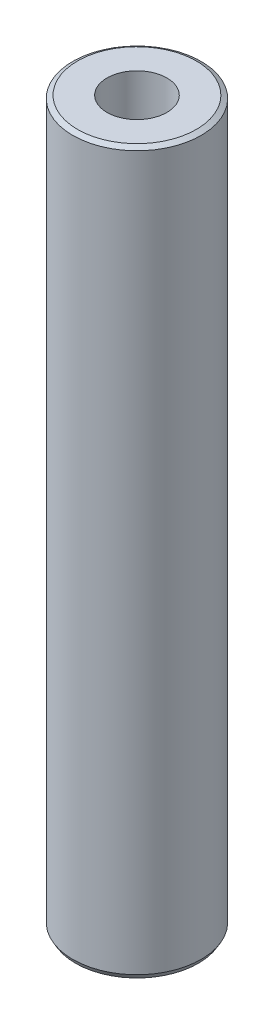
from build123d import *
from OCP.BRepFilletAPI import BRepFilletAPI_MakeChamfer

# Parameters (mm, degrees)
SKETCH1_R           = 50
BOSS_EXTRUDE1_DEPTH = 561.899542214
SKETCH2_R           = 23.319414117
CUT_EXTRUDE1_DEPTH  = 567.331259547
CHAMFER1_SIZE       = 2.159374837
CHAMFER1_SIZE2      = 3.74014693


with BuildPart() as part:
    # Sketch1 → Boss-Extrude1 (new body)
    with BuildSketch(Plane(origin=(0, 0, 0), x_dir=(1, 0, 0), z_dir=(0, 1, 0))):
        Circle(SKETCH1_R)
    extrude(amount=BOSS_EXTRUDE1_DEPTH)

    # Sketch2 → Cut-Extrude1 (cut, through all)
    with BuildSketch(Plane(origin=(0, 0, 0), x_dir=(1, 0, 0), z_dir=(0, 1, 0))):
        Circle(SKETCH2_R)
    extrude(amount=CUT_EXTRUDE1_DEPTH, mode=Mode.SUBTRACT)

    # Chamfer1: one chamfer whose edges measure the first distance from different faces: ONE call of the kernel's chamfer builder (chamfer() names one face for all edges)
    chamfer1_edges_1 = [part.edges().sort_by_distance(p)[0] for p in [
        (-50, 561.899542214, 0),
    ]]
    chamfer1_side_1 = [part.faces().sort_by_distance(p)[0] for p in [
        (-50, 280.949771107, 0),
    ]]
    chamfer1_edges_2 = [part.edges().sort_by_distance(p)[0] for p in [
        (-50, 0, 0),
    ]]
    chamfer1_side_2 = [part.faces().sort_by_distance(p)[0] for p in [
        (-48.585786438, 0, 0),
    ]]
    chamfer1 = BRepFilletAPI_MakeChamfer(part.part.solid().wrapped)
    for e in chamfer1_edges_1:
        chamfer1.Add(CHAMFER1_SIZE, CHAMFER1_SIZE2, e.wrapped, chamfer1_side_1[0].wrapped)  # the first distance lies on this face
    for e in chamfer1_edges_2:
        chamfer1.Add(CHAMFER1_SIZE, CHAMFER1_SIZE2, e.wrapped, chamfer1_side_2[0].wrapped)  # the first distance lies on this face
    add(Compound.cast(chamfer1.Shape()), mode=Mode.REPLACE)


solid = part.part
